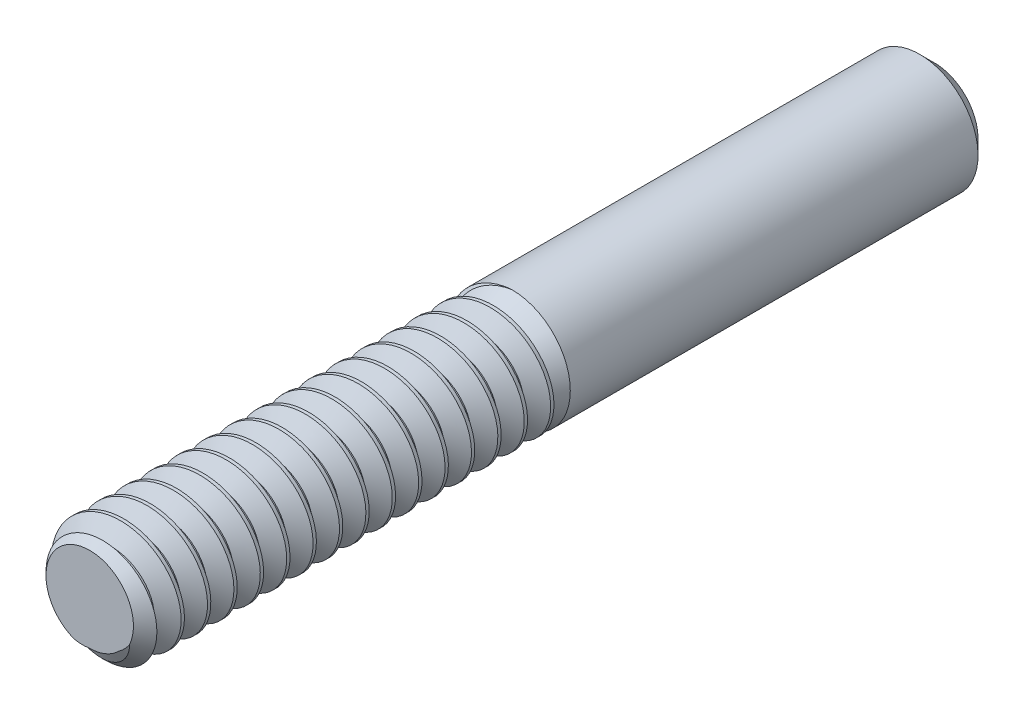
from build123d import *

# Parameters (mm, degrees)
CHAMFER1_SIZE       = 0.43815
CHAMFER2_SIZE       = 0.43815
CUT_SWEEP1_PITCH    = 0.79375
CUT_SWEEP1_TO       = 12.7
SKETCH6_R           = 1.7526
BOSS_EXTRUDE1_DEPTH = 12.7
BOSS_EXTRUDE1_TAPER = 30


with BuildPart() as part:
    # Sketch3 → Revolve1 (revolve)
    with BuildSketch(Plane(origin=(0, 0, 0), x_dir=(0, 0, -1), z_dir=(1, 0, 0)), mode=Mode.PRIVATE) as revolve1_sk:
        Polygon((-12.7, 0), (12.7, 0), (12.7, 1.7526), (0, 1.7526), (-12.7, 1.7526), align=None)
    revolve(revolve1_sk.sketch.rotate(Axis((0, 0, 12.7), (0, 0, -1)), 180), axis=Axis((0, 0, 12.7), (0, 0, -1)))

    # Chamfer1
    chamfer1_edges = [part.edges().sort_by_distance(p)[0] for p in [
        (0, 1.7526, 12.7),
    ]]
    chamfer(chamfer1_edges, length=CHAMFER1_SIZE)

    # Chamfer2
    chamfer2_edges = [part.edges().sort_by_distance(p)[0] for p in [
        (0, 1.7526, -12.7),
    ]]
    chamfer(chamfer2_edges, length=CHAMFER2_SIZE)


with BuildPart() as body_2:
    # Split1: the piece on the far side of the plane
    add(part.part)
    split(bisect_by=Plane.XY, keep=Keep.BOTTOM)


with BuildPart() as part_1:
    add(part.part)

    # Split1
    split(bisect_by=Plane.XY, keep=Keep.TOP)

    # Cut-Sweep1: arcs per turn and ends read off the stored shape
    # Cut-Sweep1: the profile of Sketch5 screwed along a right-hand helix through 17 turns, 8 arcs to a turn; built about Z, then put on its axis
    cut_sweep1_z = Axis((0, 0, 0), (0, 0, 1))
    cut_sweep1_corners = [(1.795562979, 0, -0.719335937), (1.795562979, 0, 0.024804687), (1.237044252, 0, -0.29765625), (1.237044252, 0, -0.396875)]
    with BuildLine(mode=Mode.PRIVATE) as cut_sweep1_profile:
        Line(cut_sweep1_corners[0], cut_sweep1_corners[1])
        Line(cut_sweep1_corners[1], cut_sweep1_corners[2])
        Line(cut_sweep1_corners[2], cut_sweep1_corners[3])
        Line(cut_sweep1_corners[3], cut_sweep1_corners[0])
    cut_sweep1_cap = Face(cut_sweep1_profile.wire())
    cut_sweep1_turn_angles = [0, 22.5, 45, 67.5, 90, 112.5, 135, 157.5, 180, 202.5, 225, 247.5, 270, 292.5, 315, 337.5, 360]
    cut_sweep1_turn_weights = [1, 0.9238795325112867, 1, 0.9238795325112867, 1, 0.9238795325112867, 1, 0.9238795325112867, 1, 0.9238795325112867, 1, 0.9238795325112867, 1, 0.9238795325112867, 1, 0.9238795325112867, 1]
    cut_sweep1_turn_rails = [Edge.make_bspline([Vector(p[0], p[1], 0).rotate(cut_sweep1_z, cut_sweep1_turn_angles[k]) / cut_sweep1_turn_weights[k] + Vector(0, 0, p[2] + CUT_SWEEP1_PITCH * cut_sweep1_turn_angles[k] / 360) for k in range(17)], [0, 0, 0, 1, 1, 2, 2, 3, 3, 4, 4, 5, 5, 6, 6, 7, 7, 8, 8, 8], 2, cut_sweep1_turn_weights) for p in cut_sweep1_corners]
    cut_sweep1_turn_sides = [Face.make_surface_from_curves(cut_sweep1_turn_rails[p[0]], cut_sweep1_turn_rails[p[1]]) for p in [(0, 1), (1, 2), (2, 3), (3, 0)]]
    cut_sweep1 = Plane(origin=(0, 0, 12.7), x_dir=(0, 1, 0), z_dir=(0, 0, -1)) * split(Solid(Shell([*[p.moved(Location((0, 0, CUT_SWEEP1_PITCH * i))) for i in range(17) for p in cut_sweep1_turn_sides], cut_sweep1_cap, cut_sweep1_cap.rotate(cut_sweep1_z, 6120).moved(Location((0, 0, CUT_SWEEP1_PITCH * 6120 / 360)))])), bisect_by=Plane.XY.offset(CUT_SWEEP1_TO), keep=Keep.BOTTOM, mode=Mode.PRIVATE)
    add(cut_sweep1, mode=Mode.SUBTRACT)

    add(body_2.part)  # Boss-Extrude1 merges body 2
    # Sketch6 → Boss-Extrude1 (add, through all)
    with BuildSketch(Plane.XY):
        with Locations(Location((0, 0, 0), (0, 0, 270))):
            Circle(SKETCH6_R)
    extrude(amount=BOSS_EXTRUDE1_DEPTH, taper=BOSS_EXTRUDE1_TAPER)


solid = part_1.part
